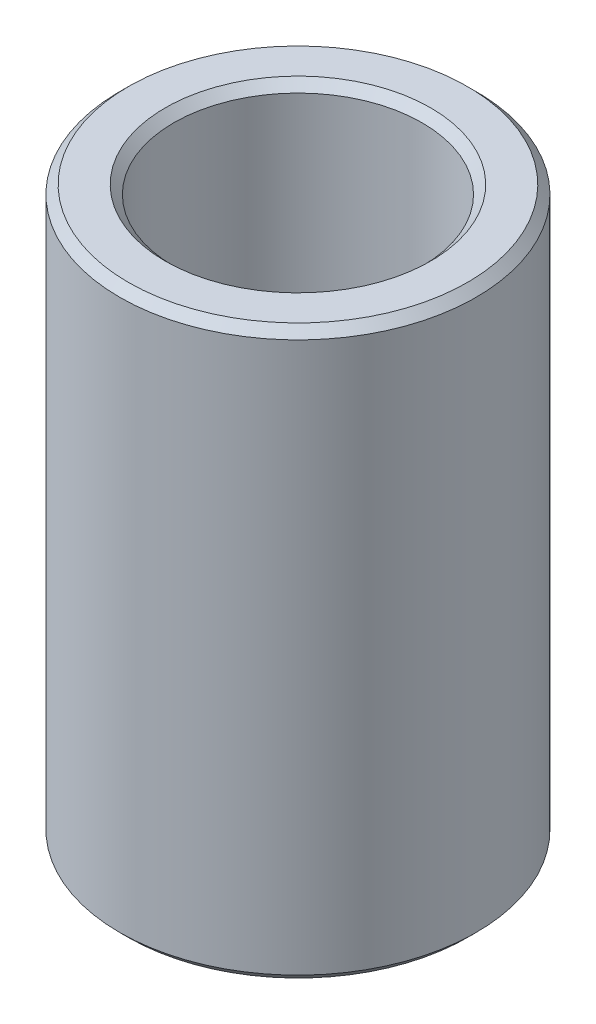
from build123d import *

# Parameters (mm, degrees)
SKETCH1_R           = 52.5
BOSS_EXTRUDE1_DEPTH = 167.137593941
SKETCH2_R           = 36.578661871
CUT_EXTRUDE1_DEPTH  = 183.886509366
CHAMFER1_SIZE       = 2.536252073


with BuildPart() as part:
    # Sketch1 → Boss-Extrude1 (new body)
    with BuildSketch(Plane(origin=(0, 0, 0), x_dir=(1, 0, 0), z_dir=(0, 1, 0))):
        Circle(SKETCH1_R)
    extrude(amount=BOSS_EXTRUDE1_DEPTH)

    # Sketch2 → Cut-Extrude1 (cut, through all)
    with BuildSketch(Plane(origin=(0, 0, 0), x_dir=(1, 0, 0), z_dir=(0, 1, 0))):
        Circle(SKETCH2_R)
    extrude(amount=CUT_EXTRUDE1_DEPTH, mode=Mode.SUBTRACT)

    # Chamfer1
    chamfer1_edges = [part.edges().sort_by_distance(p)[0] for p in [
        (-36.578661871, 167.137593941, 0),
        (-36.578661871, 0, 0),
        (-52.5, 0, 0),
        (-52.5, 167.137593941, 0),
    ]]
    chamfer(chamfer1_edges, length=CHAMFER1_SIZE)


solid = part.part
